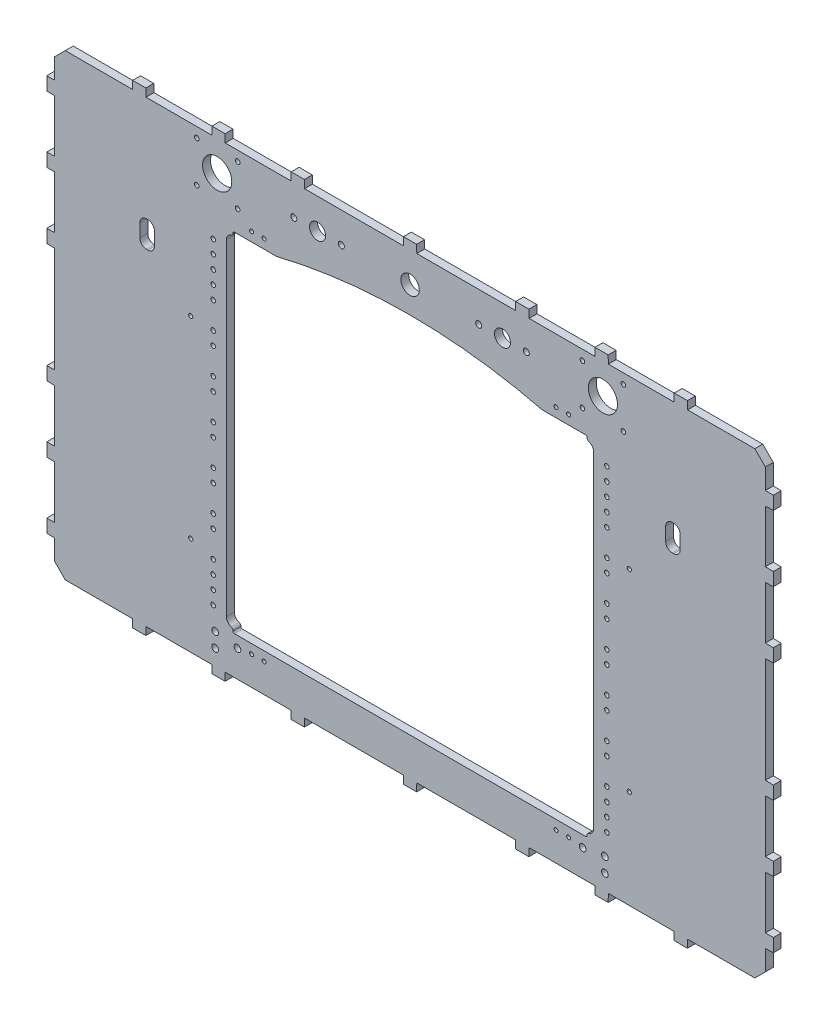
from build123d import *

# Parameters (mm, degrees)
SKETCH_1_R      = 1.6
SKETCH_1_R_2    = 1.5
SKETCH_1_R_3    = 2.55
SKETCH_1_R_4    = 1.75
SKETCH_1_R_5    = 11.05
SKETCH_1_R_6    = 2.3
SKETCH_1_R_7    = 6.05
SKETCH_1_R_8    = 7
EXTRUDE_1_DEPTH = 6


with BuildPart() as part:
    # Эскиз1 → Бобышка-Вытянуть1 (new body)
    with BuildSketch(Plane.XY):
        Polygon((1843.680450761, 414.691345467), (1893.480450761, 414.691345467), (1893.580450761, 408.691345469), (1903.580450761, 408.691345469), (1903.680450761, 414.691345467), (1954.58045076, 414.691345467), (1962.58045076, 422.691345467), (1962.58045076, 438.091345466), (1968.580450759, 438.191345467), (1968.580450759, 448.191345467), (1962.580450761, 448.291345467), (1962.580450761, 488.091345466), (1968.580450759, 488.191345467), (1968.580450759, 498.191345467), (1962.580450761, 498.291345467), (1962.580450761, 538.091345466), (1968.580450759, 538.191345467), (1968.580450759, 548.191345467), (1962.580450761, 548.291345467), (1962.580450761, 628.091345466), (1968.580450759, 628.191345467), (1968.580450759, 638.191345467), (1962.580450761, 638.291345467), (1962.580450761, 678.091345466), (1968.580450759, 678.191345467), (1968.580450759, 688.191345467), (1962.580450761, 688.291345467), (1962.580450761, 728.091345466), (1968.580450759, 728.191345467), (1968.580450759, 738.191345467), (1962.580450761, 738.291345469), (1962.580450761, 753.691345469), (1954.580450761, 761.691345469), (1903.680450761, 761.691345469), (1903.58045076, 767.691345468), (1893.58045076, 767.691345468), (1893.48045076, 761.691345469), (1854.58045076, 761.691345469), (1843.680450761, 761.691345469), (1843.58045076, 767.691345468), (1833.58045076, 767.691345468), (1833.48045076, 761.691345469), (1783.680450761, 761.691345469), (1783.58045076, 767.691345468), (1773.58045076, 767.691345468), (1773.48045076, 761.691345469), (1698.680450762, 761.691345469), (1698.580450761, 767.691345468), (1688.580450761, 767.691345468), (1688.480450761, 761.691345469), (1613.680450761, 761.691345469), (1613.58045076, 767.691345468), (1603.58045076, 767.691345468), (1603.48045076, 761.691345469), (1553.680450761, 761.691345469), (1553.58045076, 767.691345468), (1543.58045076, 767.691345468), (1543.48045076, 761.691345469), (1532.58045076, 761.691345469), (1493.680450761, 761.691345469), (1493.58045076, 767.691345468), (1483.58045076, 767.691345468), (1483.48045076, 761.691345469), (1432.580450761, 761.691345469), (1424.580450761, 753.691345469), (1424.580450761, 738.291345469), (1418.580450762, 738.191345469), (1418.580450762, 728.191345469), (1424.580450761, 728.091345469), (1424.580450761, 688.291345469), (1418.580450762, 688.191345469), (1418.580450762, 678.191345469), (1424.580450761, 678.091345469), (1424.580450761, 638.291345469), (1418.580450762, 638.191345469), (1418.580450762, 628.191345469), (1424.580450761, 628.091345469), (1424.580450761, 548.291345469), (1418.580450762, 548.191345469), (1418.580450762, 538.191345469), (1424.580450761, 538.091345468), (1424.580450761, 498.291345469), (1418.580450762, 498.191345469), (1418.580450762, 488.191345469), (1424.58045076, 488.091345468), (1424.58045076, 448.291345469), (1418.580450762, 448.191345469), (1418.580450762, 438.191345469), (1424.58045076, 438.091345468), (1424.58045076, 422.691345469), (1432.58045076, 414.691345469), (1483.48045076, 414.691345469), (1483.580450761, 408.69134547), (1493.580450761, 408.69134547), (1493.680450761, 414.691345469), (1532.58045076, 414.691345469), (1543.48045076, 414.691345469), (1543.580450761, 408.69134547), (1553.580450761, 408.69134547), (1553.680450761, 414.691345469), (1603.48045076, 414.691345469), (1603.580450761, 408.69134547), (1613.580450761, 408.69134547), (1613.680450761, 414.691345468), (1688.480450761, 414.691345468), (1688.580450761, 408.691345469), (1698.580450761, 408.691345469), (1698.680450761, 414.691345468), (1773.480450761, 414.691345468), (1773.580450761, 408.691345469), (1783.580450761, 408.691345469), (1783.680450761, 414.691345467), (1833.480450761, 414.691345467), (1833.580450761, 408.691345469), (1843.580450761, 408.691345469), align=None)
        with Locations((1859.58045076, 489.241345467)):
            Circle(SKETCH_1_R, mode=Mode.SUBTRACT)
        with Locations((1859.58045076, 635.241345467)):
            Circle(SKETCH_1_R, mode=Mode.SUBTRACT)
        with Locations((1527.58045076, 489.241345467)):
            Circle(SKETCH_1_R, mode=Mode.SUBTRACT)
        with Locations((1527.58045076, 635.241345467)):
            Circle(SKETCH_1_R, mode=Mode.SUBTRACT)
        with Locations((1804.08045076, 436.470646701)):
            Circle(SKETCH_1_R_2, mode=Mode.SUBTRACT)
        with Locations((1813.58045076, 436.470646701)):
            Circle(SKETCH_1_R_2, mode=Mode.SUBTRACT)
        with Locations((1824.227659727, 434.980879116)):
            Circle(SKETCH_1_R_3, mode=Mode.SUBTRACT)
        with Locations((1841.08045076, 426.691345469)):
            Circle(SKETCH_1_R_3, mode=Mode.SUBTRACT)
        with Locations((1841.08045076, 437.691345469)):
            Circle(SKETCH_1_R_3, mode=Mode.SUBTRACT)
        with Locations((1842.58045076, 454.191345469)):
            Circle(SKETCH_1_R_4, mode=Mode.SUBTRACT)
        with Locations((1842.58045076, 464.191345469)):
            Circle(SKETCH_1_R_4, mode=Mode.SUBTRACT)
        with Locations((1842.58045076, 474.191345469)):
            Circle(SKETCH_1_R_4, mode=Mode.SUBTRACT)
        with Locations((1842.58045076, 484.191345469)):
            Circle(SKETCH_1_R_4, mode=Mode.SUBTRACT)
        with Locations((1842.58045076, 504.191345469)):
            Circle(SKETCH_1_R_4, mode=Mode.SUBTRACT)
        with Locations((1842.58045076, 514.191345469)):
            Circle(SKETCH_1_R_4, mode=Mode.SUBTRACT)
        with Locations((1842.58045076, 534.191345469)):
            Circle(SKETCH_1_R_4, mode=Mode.SUBTRACT)
        with Locations((1842.58045076, 544.191345469)):
            Circle(SKETCH_1_R_4, mode=Mode.SUBTRACT)
        with Locations((1842.58045076, 564.191345469)):
            Circle(SKETCH_1_R_4, mode=Mode.SUBTRACT)
        with Locations((1842.58045076, 574.191345469)):
            Circle(SKETCH_1_R_4, mode=Mode.SUBTRACT)
        with Locations((1842.58045076, 594.191345469)):
            Circle(SKETCH_1_R_4, mode=Mode.SUBTRACT)
        with Locations((1842.58045076, 604.191345469)):
            Circle(SKETCH_1_R_4, mode=Mode.SUBTRACT)
        with Locations((1842.58045076, 624.191345469)):
            Circle(SKETCH_1_R_4, mode=Mode.SUBTRACT)
        with Locations((1842.58045076, 634.191345469)):
            Circle(SKETCH_1_R_4, mode=Mode.SUBTRACT)
        with Locations((1842.58045076, 654.191345469)):
            Circle(SKETCH_1_R_4, mode=Mode.SUBTRACT)
        with Locations((1842.58045076, 664.191345469)):
            Circle(SKETCH_1_R_4, mode=Mode.SUBTRACT)
        with Locations((1842.58045076, 674.191345469)):
            Circle(SKETCH_1_R_4, mode=Mode.SUBTRACT)
        with Locations((1842.58045076, 684.191345469)):
            Circle(SKETCH_1_R_4, mode=Mode.SUBTRACT)
        with Locations((1842.58045076, 694.191345469)):
            Circle(SKETCH_1_R_4, mode=Mode.SUBTRACT)
        with Locations((1583.08045076, 436.470646701)):
            Circle(SKETCH_1_R_2, mode=Mode.SUBTRACT)
        with Locations((1573.58045076, 436.470646701)):
            Circle(SKETCH_1_R_2, mode=Mode.SUBTRACT)
        with Locations((1562.93045076, 434.980879116)):
            Circle(SKETCH_1_R_3, mode=Mode.SUBTRACT)
        with Locations((1546.08045076, 426.691345469)):
            Circle(SKETCH_1_R_3, mode=Mode.SUBTRACT)
        with Locations((1546.08045076, 437.691345469)):
            Circle(SKETCH_1_R_3, mode=Mode.SUBTRACT)
        with Locations((1544.58045076, 454.191345688)):
            Circle(SKETCH_1_R_4, mode=Mode.SUBTRACT)
        with Locations((1544.58045076, 464.191345688)):
            Circle(SKETCH_1_R_4, mode=Mode.SUBTRACT)
        with Locations((1544.58045076, 474.191345688)):
            Circle(SKETCH_1_R_4, mode=Mode.SUBTRACT)
        with Locations((1544.58045076, 484.191345688)):
            Circle(SKETCH_1_R_4, mode=Mode.SUBTRACT)
        with Locations((1544.58045076, 504.191345688)):
            Circle(SKETCH_1_R_4, mode=Mode.SUBTRACT)
        with Locations((1544.58045076, 514.191345688)):
            Circle(SKETCH_1_R_4, mode=Mode.SUBTRACT)
        with Locations((1544.58045076, 534.191345688)):
            Circle(SKETCH_1_R_4, mode=Mode.SUBTRACT)
        with Locations((1544.58045076, 544.191345688)):
            Circle(SKETCH_1_R_4, mode=Mode.SUBTRACT)
        with Locations((1544.58045076, 564.191345688)):
            Circle(SKETCH_1_R_4, mode=Mode.SUBTRACT)
        with Locations((1544.58045076, 574.191345688)):
            Circle(SKETCH_1_R_4, mode=Mode.SUBTRACT)
        with Locations((1544.58045076, 594.191345688)):
            Circle(SKETCH_1_R_4, mode=Mode.SUBTRACT)
        with Locations((1544.58045076, 604.191345688)):
            Circle(SKETCH_1_R_4, mode=Mode.SUBTRACT)
        with Locations((1544.58045076, 624.191345688)):
            Circle(SKETCH_1_R_4, mode=Mode.SUBTRACT)
        with Locations((1544.58045076, 634.191345688)):
            Circle(SKETCH_1_R_4, mode=Mode.SUBTRACT)
        with Locations((1544.58045076, 654.191345688)):
            Circle(SKETCH_1_R_4, mode=Mode.SUBTRACT)
        with Locations((1544.58045076, 664.191345688)):
            Circle(SKETCH_1_R_4, mode=Mode.SUBTRACT)
        with Locations((1544.58045076, 674.191345688)):
            Circle(SKETCH_1_R_4, mode=Mode.SUBTRACT)
        with Locations((1544.58045076, 684.191345688)):
            Circle(SKETCH_1_R_4, mode=Mode.SUBTRACT)
        with Locations((1544.58045076, 694.191345688)):
            Circle(SKETCH_1_R_4, mode=Mode.SUBTRACT)
        with Locations((1804.08045076, 713.691345469)):
            Circle(SKETCH_1_R_2, mode=Mode.SUBTRACT)
        with Locations((1813.58045076, 713.691345469)):
            Circle(SKETCH_1_R_2, mode=Mode.SUBTRACT)
        with Locations((1824.08045076, 723.191345469)):
            Circle(SKETCH_1_R_4, mode=Mode.SUBTRACT)
        with Locations((1855.08045076, 723.191345469)):
            Circle(SKETCH_1_R_4, mode=Mode.SUBTRACT)
        with Locations((1839.58045076, 738.691345469)):
            Circle(SKETCH_1_R_5, mode=Mode.SUBTRACT)
        with Locations((1855.08045076, 754.191345469)):
            Circle(SKETCH_1_R_4, mode=Mode.SUBTRACT)
        with Locations((1824.08045076, 754.191345469)):
            Circle(SKETCH_1_R_4, mode=Mode.SUBTRACT)
        with Locations((1781.58045076, 738.691345469)):
            Circle(SKETCH_1_R_6, mode=Mode.SUBTRACT)
        with Locations((1763.58045076, 738.691345469)):
            Circle(SKETCH_1_R_7, mode=Mode.SUBTRACT)
        with Locations((1745.58045076, 738.691345469)):
            Circle(SKETCH_1_R_6, mode=Mode.SUBTRACT)
        with Locations((1693.58045076, 738.691345469)):
            Circle(SKETCH_1_R_8, mode=Mode.SUBTRACT)
        with Locations((1641.58045076, 738.691345469)):
            Circle(SKETCH_1_R_6, mode=Mode.SUBTRACT)
        with Locations((1623.58045076, 738.691345469)):
            Circle(SKETCH_1_R_7, mode=Mode.SUBTRACT)
        with Locations((1605.58045076, 738.691345469)):
            Circle(SKETCH_1_R_6, mode=Mode.SUBTRACT)
        with Locations((1583.08045076, 713.691345469)):
            Circle(SKETCH_1_R_2, mode=Mode.SUBTRACT)
        with Locations((1573.58045076, 713.691345469)):
            Circle(SKETCH_1_R_2, mode=Mode.SUBTRACT)
        with Locations((1563.08045076, 723.191345469)):
            Circle(SKETCH_1_R_4, mode=Mode.SUBTRACT)
        with Locations((1563.08045076, 754.191345469)):
            Circle(SKETCH_1_R_4, mode=Mode.SUBTRACT)
        with Locations((1547.58045076, 738.691345469)):
            Circle(SKETCH_1_R_5, mode=Mode.SUBTRACT)
        with Locations((1532.08045076, 723.191345469)):
            Circle(SKETCH_1_R_4, mode=Mode.SUBTRACT)
        with Locations((1532.08045076, 754.191345469)):
            Circle(SKETCH_1_R_4, mode=Mode.SUBTRACT)
        with BuildLine():
            Line((1554.58045076, 451.470646701), (1554.58045076, 698.691345469))
            ThreePointArc((1554.58045076, 698.691345469), (1555.571532132, 701.679416993), (1558.151879332, 703.482919707))
            ThreePointArc((1558.151879332, 703.482919707), (1559.184018212, 704.204320793), (1559.58045076, 705.399549402))
            Line((1559.58045076, 705.399549402), (1559.58045076, 705.691345469))
            ThreePointArc((1559.58045076, 705.691345469), (1559.873343979, 706.398452251), (1560.58045076, 706.691345469))
            Line((1560.58045076, 706.691345469), (1592.563784093, 706.691345469))
            ThreePointArc((1592.563784093, 706.691345469), (1693.122117427, 718.84112619), (1793.680450761, 706.691345469))
            Line((1793.680450761, 706.691345469), (1826.580467982, 706.691345469))
            ThreePointArc((1826.580467982, 706.691345469), (1827.287574764, 706.398452251), (1827.580467982, 705.691345469))
            Line((1827.580467982, 705.691345469), (1827.580467982, 705.399549402))
            ThreePointArc((1827.580467982, 705.399549402), (1827.976900531, 704.204320793), (1829.009039411, 703.482919707))
            ThreePointArc((1829.009039411, 703.482919707), (1831.589391061, 701.679411023), (1832.580467982, 698.691330578))
            Line((1832.580467982, 698.691330578), (1832.579713792, 451.470631809))
            ThreePointArc((1832.579713792, 451.470631809), (1831.588627971, 448.482569208), (1829.008285221, 446.679072463))
            ThreePointArc((1829.008285221, 446.679072463), (1827.976146341, 445.957671378), (1827.579713792, 444.762442768))
            Line((1827.579713792, 444.762442768), (1827.579713792, 444.470646701))
            ThreePointArc((1827.579713792, 444.470646701), (1827.286820574, 443.76353992), (1826.579713792, 443.470646701))
            Line((1826.579713792, 443.470646701), (1560.58045076, 443.470646701))
            ThreePointArc((1560.58045076, 443.470646701), (1559.873343979, 443.763539919), (1559.58045076, 444.470646701))
            Line((1559.58045076, 444.470646701), (1559.58045076, 444.762442768))
            ThreePointArc((1559.58045076, 444.762442768), (1559.184018212, 445.957671377), (1558.151879332, 446.679072463))
            ThreePointArc((1558.151879332, 446.679072463), (1555.571532132, 448.482575177), (1554.58045076, 451.470646701))
        make_face(mode=Mode.SUBTRACT)
        with BuildLine():
            Line((1495.08045076, 662.129652746), (1494.08045076, 662.129652746))
            ThreePointArc((1494.08045076, 662.129652746), (1490.544916854, 663.59411884), (1489.08045076, 667.129652746))
            Line((1489.08045076, 667.129652746), (1489.08045076, 677.129652746))
            ThreePointArc((1489.08045076, 677.129652746), (1490.544916854, 680.665186652), (1494.08045076, 682.129652746))
            Line((1494.08045076, 682.129652746), (1495.08045076, 682.129652746))
            ThreePointArc((1495.08045076, 682.129652746), (1498.615984666, 680.665186652), (1500.08045076, 677.129652746))
            Line((1500.08045076, 677.129652746), (1500.08045076, 667.129652746))
            ThreePointArc((1500.08045076, 667.129652746), (1498.615984666, 663.59411884), (1495.08045076, 662.129652746))
        make_face(mode=Mode.SUBTRACT)
        with BuildLine():
            Line((1892.08045076, 682.129652746), (1893.08045076, 682.129652746))
            ThreePointArc((1893.08045076, 682.129652746), (1896.615984666, 680.665186652), (1898.08045076, 677.129652746))
            Line((1898.08045076, 677.129652746), (1898.08045076, 667.129652746))
            ThreePointArc((1898.08045076, 667.129652746), (1896.615984666, 663.59411884), (1893.08045076, 662.129652746))
            Line((1893.08045076, 662.129652746), (1892.08045076, 662.129652746))
            ThreePointArc((1892.08045076, 662.129652746), (1888.544916854, 663.59411884), (1887.08045076, 667.129652746))
            Line((1887.08045076, 667.129652746), (1887.08045076, 677.129652746))
            ThreePointArc((1887.08045076, 677.129652746), (1888.544916854, 680.665186652), (1892.08045076, 682.129652746))
        make_face(mode=Mode.SUBTRACT)
    extrude(amount=EXTRUDE_1_DEPTH)


solid = part.part
